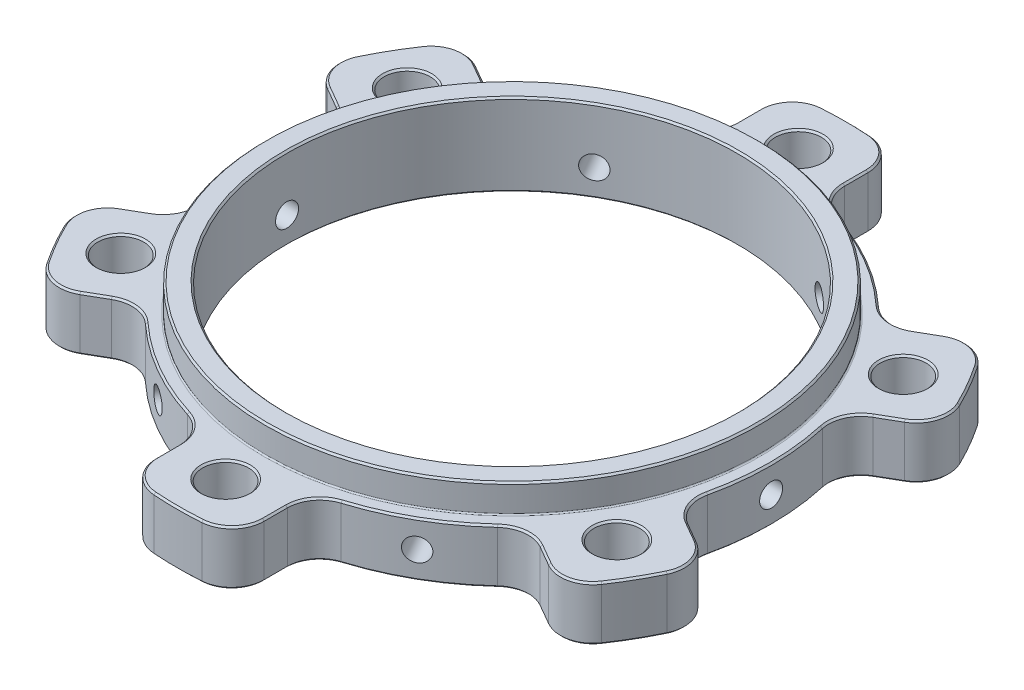
from build123d import *

# Parameters (mm, degrees)
SKETCH2_R               = 76.2
SKETCH2_R_2             = 66.167
BOSS_EXTRUDE2_DEPTH     = 7.9375
BOSS_EXTRUDE4_START     = -7.9375
SKETCH2_5_R             = 72.39
SKETCH2_5_R_2           = 66.167
BOSS_EXTRUDE4_DEPTH     = 24.13
BOSS_EXTRUDE3_DEPTH     = 7.9375
F_1_2_CLEARANCE_HOLE1_D = 13.4874
SKETCH7_W               = 3.3782
SKETCH7_H               = 76.2
CIRPATTERN1_START       = -7.9375
CIRPATTERN1_OUTLINE_R   = 6.7437
CIRPATTERN1_DEPTH       = 15.875
CIRPATTERN1_START_2     = -76.2000001
CIRPATTERN1_2_OUTLINE_R = 3.3782
CIRPATTERN1_2_DEPTH     = 10.119294592
CIRPATTERN1_3_OUTLINE_R = 3.3782
CIRPATTERN1_3_DEPTH     = 152.400000145
CIRPATTERN1_4_OUTLINE_R = 3.3782
CIRPATTERN1_4_DEPTH     = 152.400000145
FILLET1_R               = 9.525
FILLET2_R               = 0.381
CHAMFER1_SIZE           = 0.508


# Read off the part's stored shape, not the designer's step: CirPattern1
with BuildPart() as part:
    # Sketch2 → Boss-Extrude2 (new, symmetric)
    with BuildSketch(Plane(origin=(0, 0, 0), x_dir=(1, 0, 0), z_dir=(0, 1, 0))):
        with Locations(Location((0, 0, 0), (0, 0, 270))):
            Circle(SKETCH2_R)
        with Locations(Location((0, 0, 0), (0, 0, 270))):
            Circle(SKETCH2_R_2, mode=Mode.SUBTRACT)
    extrude(amount=BOSS_EXTRUDE2_DEPTH, both=True)

    # Sketch2<5> → Boss-Extrude4 (add)
    with BuildSketch(Plane(origin=(0, 0, 0), x_dir=(1, 0, 0), z_dir=(0, 1, 0)).offset(BOSS_EXTRUDE4_START)):
        with Locations(Location((0, 0, 0), (0, 0, 90))):
            Circle(SKETCH2_5_R)
        with Locations(Location((0, 0, 0), (0, 0, 270))):
            Circle(SKETCH2_5_R_2, mode=Mode.SUBTRACT)
    extrude(amount=BOSS_EXTRUDE4_DEPTH)

    # Sketch2<3> → Boss-Extrude3 (add, symmetric)
    with BuildSketch(Plane(origin=(0, 0, 0), x_dir=(1, 0, 0), z_dir=(0, 1, 0))):
        with BuildLine():
            Line((-15.875, 97.136321734), (-15.875, 74.528010674))
            ThreePointArc((-15.875, 74.528010674), (0, 76.2), (15.875, 74.528010674))
            Line((15.875, 74.528010674), (15.875, 97.136321734))
            ThreePointArc((15.875, 97.136321734), (0, 98.425), (-15.875, 97.136321734))
        make_face()
    extrude(amount=BOSS_EXTRUDE3_DEPTH, both=True)

    # 1/2 Clearance Hole1 (through all)
    with Locations(Plane(origin=(0, 7.9375, 0), x_dir=(1, 0, 0), z_dir=(0, 1, 0))):
        with Locations((0, 84.1375)):
            Hole(F_1_2_CLEARANCE_HOLE1_D / 2)

    # Sketch7 → 1/4 Clearance Hole1 (revolve, cut)
    with BuildSketch(Plane.ZX):
        with Locations((1.6891, 38.1)):
            Rectangle(SKETCH7_W, SKETCH7_H)
    revolve(axis=Axis((-6.35, 0, 0), (1, 0, 0)), mode=Mode.SUBTRACT)

    # CirPattern1 outline → CirPattern1 (add)
    # profile 1 of 5: a face of its own
    with BuildSketch(Plane(origin=(0, 0, 0), x_dir=(1, 0, 0), z_dir=(0, 1, 0)).offset(CIRPATTERN1_START)):
        with BuildLine():
            Line((-92.060022252, 34.820007582), (-72.480650537, 23.515852052))
            ThreePointArc((-72.480650537, 23.515852052), (-65.991135768, 38.1), (-56.605650537, 51.012158622))
            Line((-56.605650537, 51.012158622), (-76.185022252, 62.316314152))
            ThreePointArc((-76.185022252, 62.316314152), (-85.238550367, 49.2125), (-92.060022252, 34.820007582))
        make_face()
        with Locations((-72.865212411, 42.06875)):
            Circle(CIRPATTERN1_OUTLINE_R, mode=Mode.SUBTRACT)
    # profile 2 of 5: a face of its own
    with BuildSketch(Plane(origin=(0, 0, 0), x_dir=(1, 0, 0), z_dir=(0, 1, 0)).offset(CIRPATTERN1_START)):
        with BuildLine():
            Line((-76.185022252, -62.316314152), (-56.605650537, -51.012158622))
            ThreePointArc((-56.605650537, -51.012158622), (-65.991135768, -38.1), (-72.480650537, -23.515852052))
            Line((-72.480650537, -23.515852052), (-92.060022252, -34.820007582))
            ThreePointArc((-92.060022252, -34.820007582), (-85.238550367, -49.2125), (-76.185022252, -62.316314152))
        make_face()
        with Locations((-72.865212411, -42.06875)):
            Circle(CIRPATTERN1_OUTLINE_R, mode=Mode.SUBTRACT)
    # profile 3 of 5: a face of its own
    with BuildSketch(Plane(origin=(0, 0, 0), x_dir=(1, 0, 0), z_dir=(0, 1, 0)).offset(CIRPATTERN1_START)):
        with BuildLine():
            Line((15.875, -97.136321734), (15.875, -74.528010674))
            ThreePointArc((15.875, -74.528010674), (0, -76.2), (-15.875, -74.528010674))
            Line((-15.875, -74.528010674), (-15.875, -97.136321734))
            ThreePointArc((-15.875, -97.136321734), (0, -98.425), (15.875, -97.136321734))
        make_face()
        with Locations((0, -84.1375)):
            Circle(CIRPATTERN1_OUTLINE_R, mode=Mode.SUBTRACT)
    # profile 4 of 5: a face of its own
    with BuildSketch(Plane(origin=(0, 0, 0), x_dir=(1, 0, 0), z_dir=(0, 1, 0)).offset(CIRPATTERN1_START)):
        with BuildLine():
            Line((92.060022252, -34.820007582), (72.480650537, -23.515852052))
            ThreePointArc((72.480650537, -23.515852052), (65.991135768, -38.1), (56.605650537, -51.012158622))
            Line((56.605650537, -51.012158622), (76.185022252, -62.316314152))
            ThreePointArc((76.185022252, -62.316314152), (85.238550367, -49.2125), (92.060022252, -34.820007582))
        make_face()
        with Locations((72.865212411, -42.06875)):
            Circle(CIRPATTERN1_OUTLINE_R, mode=Mode.SUBTRACT)
    # profile 5 of 5: a face of its own
    with BuildSketch(Plane(origin=(0, 0, 0), x_dir=(1, 0, 0), z_dir=(0, 1, 0)).offset(CIRPATTERN1_START)):
        with BuildLine():
            ThreePointArc((92.060022252, 34.820007582), (85.238550367, 49.2125), (76.185022252, 62.316314152))
            Line((76.185022252, 62.316314152), (56.605650537, 51.012158622))
            ThreePointArc((56.605650537, 51.012158622), (65.991135768, 38.1), (72.480650537, 23.515852052))
            Line((72.480650537, 23.515852052), (92.060022252, 34.820007582))
        make_face()
        with Locations((72.865212411, 42.06875)):
            Circle(CIRPATTERN1_OUTLINE_R, mode=Mode.SUBTRACT)
    extrude(amount=CIRPATTERN1_DEPTH)

    # CirPattern1 2 outline → CirPattern1 2 (cut)
    with BuildSketch(Plane.YZ.offset(CIRPATTERN1_START_2)):
        Circle(CIRPATTERN1_2_OUTLINE_R)
    extrude(amount=CIRPATTERN1_2_DEPTH, mode=Mode.SUBTRACT)

    # CirPattern1 3 outline → CirPattern1 3 (cut)
    with BuildSketch(Plane(origin=(0, 0, 0), x_dir=(0.8660254037844398, 0, -0.499999999999998), z_dir=(0.49999999999999795, 0, 0.8660254037844399)).offset(CIRPATTERN1_START_2)):
        Circle(CIRPATTERN1_3_OUTLINE_R)
    extrude(amount=CIRPATTERN1_3_DEPTH, mode=Mode.SUBTRACT)

    # CirPattern1 4 outline → CirPattern1 4 (cut)
    with BuildSketch(Plane(origin=(0, 0, 0), x_dir=(0.8660254037844362, 0, 0.5000000000000042), z_dir=(0.5000000000000042, 0, -0.8660254037844363)).offset(CIRPATTERN1_START_2)):
        Circle(CIRPATTERN1_4_OUTLINE_R)
    extrude(amount=CIRPATTERN1_4_DEPTH, mode=Mode.SUBTRACT)

    # Fillet1
    fillet1_edges = [part.edges().sort_by_distance(p)[0] for p in [
        (15.875, 0, -97.136321734),
        (-15.875, 0, -97.136321734),
        (-15.875, 0, -74.528010674),
        (15.875, 0, -74.528010674),
        (-76.185022252, 0, -62.316314152),
        (-92.060022252, 0, -34.820007582),
        (-72.480650537, 0, -23.515852052),
        (-56.605650537, 0, -51.012158622),
        (-92.060022252, 0, 34.820007582),
        (-76.185022252, 0, 62.316314152),
        (-56.605650537, 0, 51.012158622),
        (-72.480650537, 0, 23.515852052),
        (-15.875, 0, 97.136321734),
        (15.875, 0, 97.136321734),
        (15.875, 0, 74.528010674),
        (-15.875, 0, 74.528010674),
        (76.185022252, 0, 62.316314152),
        (92.060022252, 0, 34.820007582),
        (72.480650537, 0, 23.515852052),
        (56.605650537, 0, 51.012158622),
        (92.060022252, 0, -34.820007582),
        (76.185022252, 0, -62.316314152),
        (56.605650537, 0, -51.012158622),
        (72.480650537, 0, -23.515852052),
    ]]
    fillet(fillet1_edges, radius=FILLET1_R)

    # Fillet2
    fillet2_edges = [part.edges().sort_by_distance(p)[0] for p in [
        (0, 7.9375, 72.39),
    ]]
    fillet(fillet2_edges, radius=FILLET2_R)

    # Chamfer1
    chamfer1_edges = [part.edges().sort_by_distance(p)[0] for p in [
        (0, 16.1925, 72.39),
        (66.121512411, 7.9375, -42.06875),
        (0, 16.1925, -66.167),
        (66.121512411, 7.9375, 42.06875),
        (-6.7437, 7.9375, 84.1375),
        (-79.608912411, 7.9375, 42.06875),
        (-79.608912411, 7.9375, -42.06875),
        (15.875, -7.9375, 85.274267481),
        (15.875, 7.9375, 85.274267481),
        (-38.1, -7.9375, -65.991135768),
        (-15.875, -7.9375, -85.274267481),
        (0, -7.9375, -98.425),
        (15.875, -7.9375, -85.274267481),
        (38.1, -7.9375, -65.991135768),
        (65.912181928, -7.9375, -56.385287026),
        (85.238550367, -7.9375, -49.2125),
        (81.787181928, -7.9375, -28.888980456),
        (76.2, -7.9375, 0),
        (81.787181928, -7.9375, 28.888980456),
        (85.238550367, -7.9375, 49.2125),
        (65.912181928, -7.9375, 56.385287026),
        (38.1, -7.9375, 65.991135768),
        (0, -7.9375, 98.425),
        (-15.875, -7.9375, 85.274267481),
        (-38.1, -7.9375, 65.991135768),
        (-65.912181928, -7.9375, 56.385287026),
        (-85.238550367, -7.9375, 49.2125),
        (-81.787181928, -7.9375, 28.888980456),
        (-76.2, -7.9375, 0),
        (-81.787181928, -7.9375, -28.888980456),
        (-85.238550367, -7.9375, -49.2125),
        (-65.912181928, -7.9375, -56.385287026),
        (75.752884422, -7.9375, 59.118390908),
        (89.074470568, -7.9375, 36.044726865),
        (89.074470568, -7.9375, -36.044726865),
        (75.752884422, -7.9375, -59.118390908),
        (13.321586146, -7.9375, -95.163117773),
        (-13.321586146, -7.9375, -95.163117773),
        (-75.752884422, -7.9375, -59.118390908),
        (-89.074470568, -7.9375, -36.044726865),
        (-89.074470568, -7.9375, 36.044726865),
        (-75.752884422, -7.9375, 59.118390908),
        (-13.321586146, -7.9375, 95.163117773),
        (13.321586146, -7.9375, 95.163117773),
        (0, 7.9375, 98.425),
        (-38.1, 7.9375, -65.991135768),
        (-65.912181928, 7.9375, -56.385287026),
        (-85.238550367, 7.9375, -49.2125),
        (-81.787181928, 7.9375, -28.888980456),
        (-76.2, 7.9375, 0),
        (-81.787181928, 7.9375, 28.888980456),
        (-85.238550367, 7.9375, 49.2125),
        (-65.912181928, 7.9375, 56.385287026),
        (-38.1, 7.9375, 65.991135768),
        (-15.875, 7.9375, 85.274267481),
        (38.1, 7.9375, 65.991135768),
        (65.912181928, 7.9375, 56.385287026),
        (85.238550367, 7.9375, 49.2125),
        (81.787181928, 7.9375, 28.888980456),
        (76.2, 7.9375, 0),
        (81.787181928, 7.9375, -28.888980456),
        (85.238550367, 7.9375, -49.2125),
        (65.912181928, 7.9375, -56.385287026),
        (38.1, 7.9375, -65.991135768),
        (15.875, 7.9375, -85.274267481),
        (0, 7.9375, -98.425),
        (-15.875, 7.9375, -85.274267481),
        (75.752884422, 7.9375, 59.118390908),
        (89.074470568, 7.9375, 36.044726865),
        (89.074470568, 7.9375, -36.044726865),
        (75.752884422, 7.9375, -59.118390908),
        (13.321586146, 7.9375, -95.163117773),
        (-13.321586146, 7.9375, -95.163117773),
        (-75.752884422, 7.9375, -59.118390908),
        (-89.074470568, 7.9375, -36.044726865),
        (-89.074470568, 7.9375, 36.044726865),
        (-75.752884422, 7.9375, 59.118390908),
        (-13.321586146, 7.9375, 95.163117773),
        (13.321586146, 7.9375, 95.163117773),
        (-17.731646472, -7.9375, 76.225656776),
        (-17.731646472, 7.9375, 76.225656776),
        (-57.147531953, -7.9375, 53.468884684),
        (-57.147531953, 7.9375, 53.468884684),
        (-74.879178424, -7.9375, 22.756772093),
        (-74.879178424, 7.9375, 22.756772093),
        (-74.879178424, -7.9375, -22.756772093),
        (-74.879178424, 7.9375, -22.756772093),
        (-57.147531953, -7.9375, -53.468884684),
        (-57.147531953, 7.9375, -53.468884684),
        (17.731646472, -7.9375, 76.225656776),
        (17.731646472, 7.9375, 76.225656776),
        (-17.731646472, -7.9375, -76.225656776),
        (-17.731646472, 7.9375, -76.225656776),
        (17.731646472, -7.9375, -76.225656776),
        (17.731646472, 7.9375, -76.225656776),
        (57.147531953, -7.9375, -53.468884684),
        (57.147531953, 7.9375, -53.468884684),
        (74.879178424, -7.9375, -22.756772093),
        (74.879178424, 7.9375, -22.756772093),
        (74.879178424, -7.9375, 22.756772093),
        (74.879178424, 7.9375, 22.756772093),
        (57.147531953, -7.9375, 53.468884684),
        (57.147531953, 7.9375, 53.468884684),
        (0, -7.9375, -66.167),
        (6.7437, 7.9375, -84.1375),
    ]]
    chamfer(chamfer1_edges, length=CHAMFER1_SIZE)


solid = part.part
